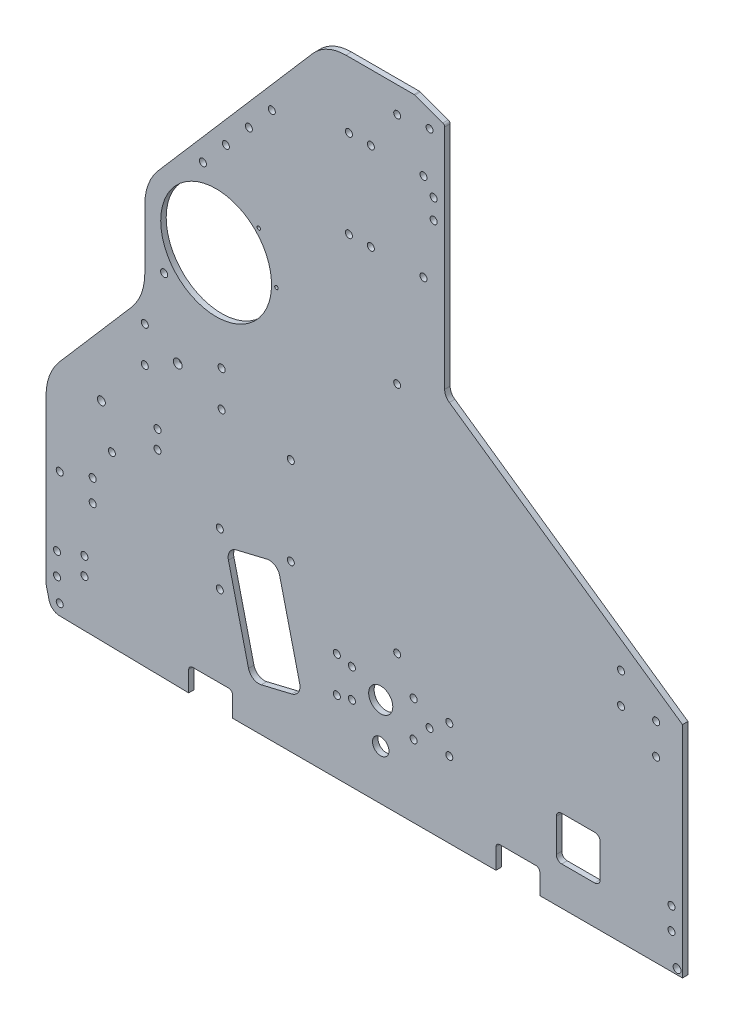
from build123d import *

# Parameters (mm, degrees)
SKETCH1_R           = 2.032
SKETCH1_R_2         = 2.54
SKETCH1_R_3         = 2
BOSS_EXTRUDE1_DEPTH = 3.175
FILLET1_R           = 2.286
FILLET2_R           = 6.35
SKETCH2_R           = 2.032
CUT_EXTRUDE1_DEPTH  = 505.524983177
FILLET3_R           = 1.5875
SKETCH3_R           = 2.032
SKETCH3_R_2         = 2.286
SKETCH3_R_3         = 1.016
CUT_EXTRUDE2_DEPTH  = 505.524983177
SKETCH4_R           = 2.032
SKETCH4_R_2         = 6.985
SKETCH4_R_3         = 4.7625
CUT_EXTRUDE3_DEPTH  = 505.524983177
SKETCH5_R           = 32.0675
SKETCH5_R_2         = 2.286000001
CUT_EXTRUDE5_DEPTH  = 505.524983177
FILLET4_R           = 31.75
CUT_EXTRUDE6_DEPTH  = 505.524983177
FILLET5_R           = 25.4
SKETCH8_R           = 2.032
CUT_EXTRUDE7_DEPTH  = 505.524983177
SKETCH10_R          = 2.032
CUT_EXTRUDE8_DEPTH  = 505.524983177


with BuildPart() as part:
    # Sketch1 → Boss-Extrude1 (new body)
    with BuildSketch(Plane.XY):
        with BuildLine():
            Line((7.829508682, -19.049081656), (82.55, -20.32))
            Line((82.55, -20.32), (82.55, -6.35))
            Line((82.55, -6.35), (107.95, -6.35))
            Line((107.95, -6.35), (107.95, -20.32))
            Line((107.95, -20.32), (260.35, -20.32))
            Line((260.35, -20.32), (260.35, -6.35))
            Line((260.35, -6.35), (285.75, -6.35))
            Line((285.75, -6.35), (285.75, -20.32))
            Line((285.75, -20.32), (368.3, -20.32))
            Line((368.3, -20.32), (368.3, 106.68))
            Line((368.3, 106.68), (230.66375, 202.565))
            Line((230.66375, 202.565), (230.66375, 338.455))
            Line((230.66375, 338.455), (213.19998, 344.805))
            Line((213.19998, 344.805), (203.2, 344.805))
            Line((203.2, 344.805), (161.925, 344.805))
            Line((161.925, 344.805), (52.720122664, 218.469945827))
            ThreePointArc((52.720122664, 218.469945827), (52.803835479, 218.142145922), (52.832, 217.805))
            ThreePointArc((52.832, 217.805), (52.095493096, 216.239521914), (50.419872403, 215.808871996))
            Line((50.419872403, 215.808871996), (0, 157.48))
            Line((0, 157.48), (0, 0))
            Line((0, 0), (0, -6.35))
            ThreePointArc((0, -6.35), (0.047577015, -7.125863724), (0.189595124, -7.890101219))
            Line((0.189595124, -7.890101219), (1.777095124, -14.240101219))
            ThreePointArc((1.777095124, -14.240101219), (3.987212552, -17.671692778), (7.829508682, -19.049081656))
        make_face()
        with Locations((7.9375, -12.7)):
            Circle(SKETCH1_R, mode=Mode.SUBTRACT)
        with Locations((6.35, 0)):
            Circle(SKETCH1_R, mode=Mode.SUBTRACT)
        with Locations((6.35, 12.7)):
            Circle(SKETCH1_R, mode=Mode.SUBTRACT)
        with Locations((38.1, 78.105)):
            Circle(SKETCH1_R, mode=Mode.SUBTRACT)
        with Locations((57.15, 131.28625)):
            Circle(SKETCH1_R, mode=Mode.SUBTRACT)
        with Locations((57.15, 151.92375)):
            Circle(SKETCH1_R, mode=Mode.SUBTRACT)
        with Locations((76.2, 141.605)):
            Circle(SKETCH1_R_2, mode=Mode.SUBTRACT)
        with Locations((101.6, 131.28625)):
            Circle(SKETCH1_R, mode=Mode.SUBTRACT)
        with Locations((101.6, 151.92375)):
            Circle(SKETCH1_R, mode=Mode.SUBTRACT)
        with Locations((203.2, 59.805)):
            Circle(SKETCH1_R_3, mode=Mode.SUBTRACT)
        with Locations((361.95, 0)):
            Circle(SKETCH1_R, mode=Mode.SUBTRACT)
        with Locations((361.95, 12.7)):
            Circle(SKETCH1_R, mode=Mode.SUBTRACT)
        with Locations((353.06, 82.955052336)):
            Circle(SKETCH1_R, mode=Mode.SUBTRACT)
        with Locations((332.74, 98.195052336)):
            Circle(SKETCH1_R, mode=Mode.SUBTRACT)
        with Locations((332.74, 115.975052336)):
            Circle(SKETCH1_R, mode=Mode.SUBTRACT)
        with Locations((353.06, 100.735052336)):
            Circle(SKETCH1_R, mode=Mode.SUBTRACT)
        with Locations((68.326, 182.923674932)):
            Circle(SKETCH1_R, mode=Mode.SUBTRACT)
        with Locations((76.2, 217.805)):
            Circle(SKETCH1_R, mode=Mode.SUBTRACT)
        with Locations((90.779500502, 249.682)):
            Circle(SKETCH1_R, mode=Mode.SUBTRACT)
        with Locations((104.067838673, 265.054783374)):
            Circle(SKETCH1_R, mode=Mode.SUBTRACT)
        with Locations((117.356176844, 280.427566748)):
            Circle(SKETCH1_R, mode=Mode.SUBTRACT)
        with Locations((130.644515014, 295.800350122)):
            Circle(SKETCH1_R, mode=Mode.SUBTRACT)
        with Locations((203.2, 194.805)):
            Circle(SKETCH1_R_3, mode=Mode.SUBTRACT)
        with Locations((224.31375, 287.401)):
            Circle(SKETCH1_R, mode=Mode.SUBTRACT)
        with Locations((224.31375, 298.831)):
            Circle(SKETCH1_R, mode=Mode.SUBTRACT)
        with Locations((203.2, 329.805)):
            Circle(SKETCH1_R_3, mode=Mode.SUBTRACT)
        with Locations((221.931865, 332.105)):
            Circle(SKETCH1_R_3, mode=Mode.SUBTRACT)
    extrude(amount=BOSS_EXTRUDE1_DEPTH)

    # Fillet1
    fillet1_edges = [part.edges().sort_by_distance(p)[0] for p in [
        (285.75, -6.35, 1.5875),
        (107.95, -6.35, 1.5875),
        (260.35, -6.35, 1.5875),
        (82.55, -6.35, 1.5875),
    ]]
    fillet(fillet1_edges, radius=FILLET1_R)

    # Fillet2
    fillet2_edges = [part.edges().sort_by_distance(p)[0] for p in [
        (230.66375, 202.565, 1.5875),
    ]]
    fillet(fillet2_edges, radius=FILLET2_R)

    # Sketch2 → Cut-Extrude1 (cut, through all)
    with BuildSketch(Plane(origin=(0, 0, 0), x_dir=(-1, 0, 0), z_dir=(0, 0, -1))):
        with Locations((-100.552770272, 71.086035298)):
            Circle(SKETCH2_R)
        with Locations((-100.552770272, 40.606035298)):
            Circle(SKETCH2_R)
        with Locations((-22.225, 18.202541089)):
            Circle(SKETCH2_R)
        with Locations((-22.225, 8.042541089)):
            Circle(SKETCH2_R)
    extrude(amount=-CUT_EXTRUDE1_DEPTH, mode=Mode.SUBTRACT)

    # Fillet3
    fillet3_edges = [part.edges().sort_by_distance(p)[0] for p in [
        (230.66375, 338.455, 1.5875),
        (213.19998, 344.805, 1.5875),
    ]]
    fillet(fillet3_edges, radius=FILLET3_R)

    # Sketch3 → Cut-Extrude2 (cut, through all)
    with BuildSketch(Plane.XY.offset(3.175)):
        with BuildLine():
            Line((127.789350211, 69.359774106), (110.09075034, 65.117184968))
            ThreePointArc((110.09075034, 65.117184968), (106.287939856, 62.356288953), (105.55119507, 57.715047577))
            Line((105.55119507, 57.715047577), (117.160037875, 9.287010566))
            ThreePointArc((117.160037875, 9.287010566), (119.920933891, 5.484200083), (124.562175266, 4.747455297))
            Line((124.562175266, 4.747455297), (142.260775138, 8.990044434))
            ThreePointArc((142.260775138, 8.990044434), (146.063585622, 11.75094045), (146.800330407, 16.392181825))
            Line((146.800330407, 16.392181825), (135.191487602, 64.820218836))
            ThreePointArc((135.191487602, 64.820218836), (132.430591587, 68.62302932), (127.789350211, 69.359774106))
        make_face()
        with Locations((26.987500002, 46.953113935)):
            Circle(SKETCH3_R)
        with Locations((26.987500002, 59.653113935)):
            Circle(SKETCH3_R)
        with Locations((7.937500002, 53.303113935)):
            Circle(SKETCH3_R)
        with Locations((32.030600738, 100.810868776)):
            Circle(SKETCH3_R_2)
        with Locations((64.525942114, 102.94048958)):
            Circle(SKETCH3_R)
        with Locations((64.525942114, 92.525786339)):
            Circle(SKETCH3_R)
        with Locations((133.35, 208.228121768)):
            Circle(SKETCH3_R_3)
        with Locations((123.120704333, 232.923826101)):
            Circle(SKETCH3_R_3)
    extrude(amount=-CUT_EXTRUDE2_DEPTH, mode=Mode.SUBTRACT)

    # Sketch4 → Cut-Extrude3 (cut, through all)
    with BuildSketch(Plane.XY.offset(3.175)):
        with Locations((168.275, 42.06875)):
            Circle(SKETCH4_R)
        with Locations((212.725, 42.06875)):
            Circle(SKETCH4_R)
        with Locations((212.725, 21.43125)):
            Circle(SKETCH4_R)
        with Locations((168.275, 21.43125)):
            Circle(SKETCH4_R)
        with Locations((193.675, 31.75)):
            Circle(SKETCH4_R_2)
        with Locations((177.00498, 40.0431)):
            Circle(SKETCH4_R)
        with Locations((177.00498, 23.4569)):
            Circle(SKETCH4_R)
        with Locations((193.675, 8.466666658)):
            Circle(SKETCH4_R_3)
        with Locations((221.931865, 31.75)):
            Circle(SKETCH4_R)
        with Locations((233.36123, 23.4569)):
            Circle(SKETCH4_R)
        with Locations((233.36123, 40.0431)):
            Circle(SKETCH4_R)
    extrude(amount=-CUT_EXTRUDE3_DEPTH, mode=Mode.SUBTRACT)

    # Sketch5 → Cut-Extrude5 (cut, through all)
    with BuildSketch(Plane(origin=(0, 0, 0), x_dir=(-1, 0, 0), z_dir=(0, 0, -1))):
        Polygon((0, 157.48), (-57.15, 223.594705882), (-57.15, 165.333696112), (0, 99.218990229), align=None)
        with Locations((-98.425, 208.228121768)):
            Circle(SKETCH5_R)
        with Locations((-365.170790347, -17.190790347)):
            Circle(SKETCH5_R_2)
    extrude(amount=-CUT_EXTRUDE5_DEPTH, mode=Mode.SUBTRACT)

    # Fillet4
    fillet4_edges = [part.edges().sort_by_distance(p)[0] for p in [
        (0, 99.218990229, 1.5875),
        (57.15, 165.333696112, 1.5875),
        (57.15, 223.594705882, 1.5875),
    ]]
    fillet(fillet4_edges, radius=FILLET4_R)

    # Sketch6 → Cut-Extrude6 (cut, through all)
    with BuildSketch(Plane.XY.offset(3.175)):
        with BuildLine():
            Line((298.45, 27.305), (317.5, 27.305))
            ThreePointArc((317.5, 27.305), (319.74506403, 26.37506403), (320.675, 24.13))
            Line((320.675, 24.13), (320.675, 5.08))
            ThreePointArc((320.675, 5.08), (319.74506403, 2.83493597), (317.5, 1.905))
            Line((317.5, 1.905), (298.45, 1.905))
            ThreePointArc((298.45, 1.905), (296.20493597, 2.83493597), (295.275, 5.08))
            Line((295.275, 5.08), (295.275, 24.13))
            ThreePointArc((295.275, 24.13), (296.20493597, 26.37506403), (298.45, 27.305))
        make_face()
    extrude(amount=-CUT_EXTRUDE6_DEPTH, mode=Mode.SUBTRACT)

    # Fillet5
    fillet5_edges = [part.edges().sort_by_distance(p)[0] for p in [
        (161.925, 344.805, 1.5875),
    ]]
    fillet(fillet5_edges, radius=FILLET5_R)

    # Sketch8 → Cut-Extrude7 (cut, through all)
    with BuildSketch(Plane(origin=(0, 0, 0), x_dir=(-1, 0, 0), z_dir=(0, 0, -1))):
        with Locations((-187.96, 306.704999913)):
            Circle(SKETCH8_R)
        with Locations((-175.26, 306.704999913)):
            Circle(SKETCH8_R)
        with Locations((-218.44, 306.704999905)):
            Circle(SKETCH8_R)
        with Locations((-218.44, 255.904999905)):
            Circle(SKETCH8_R)
        with Locations((-187.96, 255.904999913)):
            Circle(SKETCH8_R)
        with Locations((-175.26, 255.904999913)):
            Circle(SKETCH8_R)
    extrude(amount=-CUT_EXTRUDE7_DEPTH, mode=Mode.SUBTRACT)

    # Sketch10 → Cut-Extrude8 (cut, through all)
    with BuildSketch(Plane.XY.offset(3.175)):
        with Locations((141.64248, 75.160621768)):
            Circle(SKETCH10_R)
        with Locations((141.64248, 125.960621768)):
            Circle(SKETCH10_R)
    extrude(amount=-CUT_EXTRUDE8_DEPTH, mode=Mode.SUBTRACT)


solid = part.part
